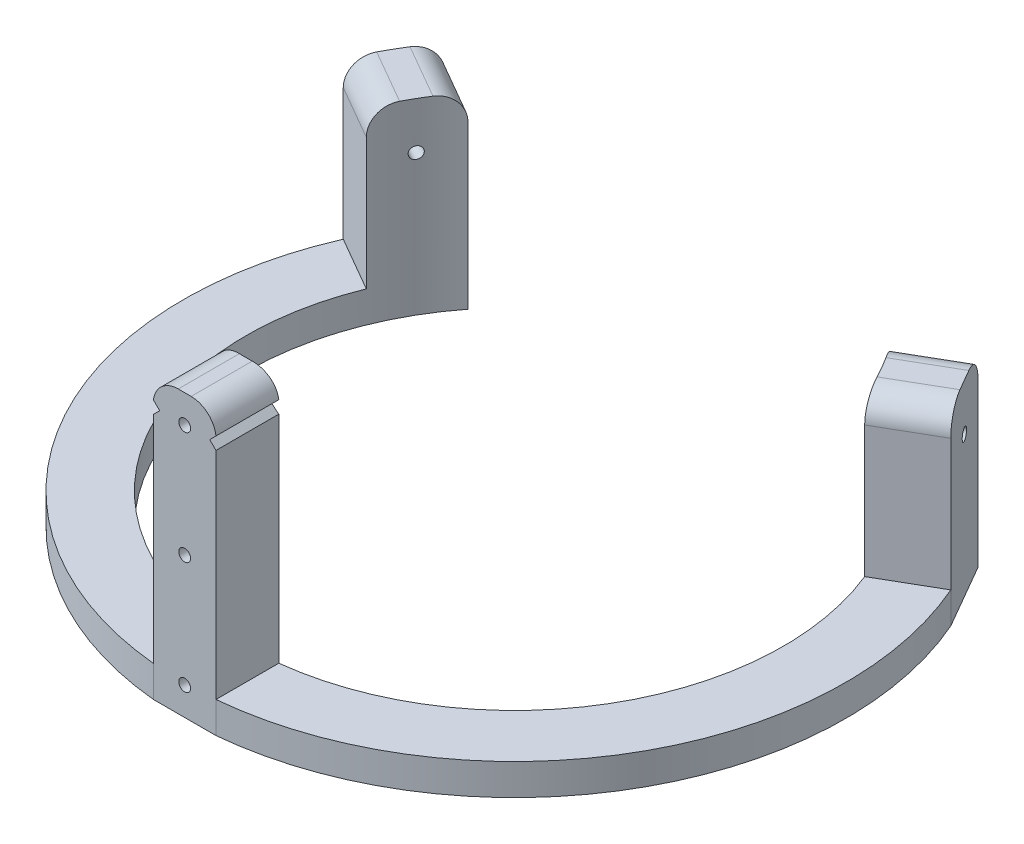
from build123d import *

# Parameters (mm, degrees)
SKETCH1_R               = 67.31
SKETCH1_R_2             = 54.61
BOSS_EXTRUDE1_DEPTH     = 57.15
CUT_EXTRUDE1_DEPTH      = 161.994729727
CUT_EXTRUDE1_DEPTH_BACK = 161.994729727
SKETCH2_R               = 1.2065
SKETCH3_R               = 1.2065
CUT_EXTRUDE2_DEPTH      = 171.985259226
CUT_EXTRUDE3_START      = -50.8
CUT_EXTRUDE3_DEPTH      = 50.8
SKETCH5_W               = 12.7
SKETCH5_H               = 152.473493429
CUT_EXTRUDE4_DEPTH      = 50.8
CUT_EXTRUDE5_START      = -19.05
CUT_EXTRUDE5_DEPTH      = 19.05
CUT_EXTRUDE6_START      = -19.05
CUT_EXTRUDE6_DEPTH      = 19.05
FILLET1_START           = 53
FILLET1_DEPTH           = 15
FILLET1_2_DEPTH         = 15
FILLET1_START_2         = -67.31
FILLET1_3_DEPTH         = 14.31
CUT_EXTRUDE7_START      = -19.05
CUT_EXTRUDE7_DEPTH      = 19.05


with BuildPart() as part:
    # Sketch1 → Boss-Extrude1 (new body)
    with BuildSketch(Plane(origin=(0, 0, 0), x_dir=(1, 0, 0), z_dir=(0, 1, 0))):
        with Locations(Location((0, 0, 0), (0, 0, 270))):
            Circle(SKETCH1_R)
        with Locations(Location((0, 0, 0), (0, 0, 270))):
            Circle(SKETCH1_R_2, mode=Mode.SUBTRACT)
    extrude(amount=BOSS_EXTRUDE1_DEPTH)

    # Sketch2 → Cut-Extrude1 (cut, two sides: drawn at the far end of the back side and taken through both)
    with BuildSketch(Plane.XY.offset(67.31).offset(-CUT_EXTRUDE1_DEPTH_BACK)):
        Polygon((-5.08, 51.435), (-6.35, 52.705), (-6.35, 50.165), align=None)
        Polygon((-6.35, 52.705), (-6.35, 57.15), (-19.05, 57.15), (-19.05, 25.0825), (-6.35, 25.0825), (-6.35, 50.165), align=None)
        Polygon((5.08, 51.435), (6.35, 50.165), (6.35, 52.705), align=None)
        Polygon((6.35, 50.165), (6.35, 25.0825), (19.05, 25.0825), (19.05, 57.15), (6.35, 57.15), (6.35, 52.705), align=None)
        with Locations((0, 51.435)):
            Circle(SKETCH2_R)
        with Locations((0, 28.575)):
            Circle(SKETCH2_R)
        with Locations((0, 5.715)):
            Circle(SKETCH2_R)
    extrude(amount=CUT_EXTRUDE1_DEPTH + CUT_EXTRUDE1_DEPTH_BACK, mode=Mode.SUBTRACT)

    # Sketch3 → Cut-Extrude2 (cut, through all)
    with BuildSketch(Plane(origin=(-58.292169929, 0, -33.655), x_dir=(0, -1, 0), z_dir=(-0.8660254037844364, 0, -0.5000000000000041))):
        with Locations(Location((-28.575, 0, 0), (0, 0, 90))):
            Circle(SKETCH3_R)
    cut_extrude2 = extrude(amount=-CUT_EXTRUDE2_DEPTH, mode=Mode.SUBTRACT)

    # Mirror1: Cut-Extrude2 across plane
    add(cut_extrude2.mirror(Plane(origin=(0, 0, 0), x_dir=(0, 0, 1), z_dir=(1, 0, 0))), mode=Mode.SUBTRACT)

    # Cut-Extrude3: read off the stored shape, not the designer's step
    # Cut-Extrude3 outline → Cut-Extrude3 (cut)
    with BuildSketch(Plane(origin=(0, 57.15, 0), x_dir=(1, 0, 0), z_dir=(0, 1, 0)).offset(CUT_EXTRUDE3_START)):
        with BuildLine():
            ThreePointArc((-6.35, -67.009802268), (0, -67.31), (6.35, -67.009802268))
            Line((6.35, -67.009802268), (-6.35, -67.009802268))
        make_face()
        with BuildLine():
            Line((6.35, -54.23955752), (6.35, -67.009802268))
            ThreePointArc((6.35, -67.009802268), (57.986556059, -34.178873833), (61.701920082, 26.898125551))
            Line((61.701920082, 26.898125551), (50.616947204, 20.498213476))
            ThreePointArc((50.616947204, 20.498213476), (46.986613751, -27.830023862), (6.35, -54.23955752))
        make_face()
        with BuildLine():
            Line((-6.35, -67.009802268), (-6.35, -54.23955752))
            ThreePointArc((-6.35, -54.23955752), (-46.986613751, -27.830023862), (-50.616947204, 20.498213476))
            Line((-50.616947204, 20.498213476), (-61.701920082, 26.898125551))
            ThreePointArc((-61.701920082, 26.898125551), (-57.986556059, -34.178873833), (-6.35, -67.009802268))
        make_face()
        with BuildLine():
            Line((54.145420082, 39.986367478), (61.701920082, 26.898125551))
            ThreePointArc((61.701920082, 26.898125551), (58.292169929, 33.655), (54.145420082, 39.986367478))
        make_face()
        with BuildLine():
            Line((-54.145420082, 39.986367478), (-43.060447204, 33.586455403))
            ThreePointArc((-43.060447204, 33.586455403), (0, 54.61), (43.060447204, 33.586455403))
            Line((43.060447204, 33.586455403), (54.145420082, 39.986367478))
            ThreePointArc((54.145420082, 39.986367478), (0, 67.31), (-54.145420082, 39.986367478))
        make_face()
    extrude(amount=CUT_EXTRUDE3_DEPTH, mode=Mode.SUBTRACT)

    # Sketch5 → Cut-Extrude4 (cut)
    with BuildSketch(Plane(origin=(0, 6.35, 0), x_dir=(1, 0, 0), z_dir=(0, 1, 0))):
        with Locations((0, 21.997189195)):
            Rectangle(SKETCH5_W, SKETCH5_H)
    extrude(amount=-CUT_EXTRUDE4_DEPTH, mode=Mode.SUBTRACT)

    # Sketch6 → Cut-Extrude5 (cut)
    with BuildSketch(Plane(origin=(0, 57.15, 0), x_dir=(1, 0, 0), z_dir=(0, 1, 0)).offset(CUT_EXTRUDE5_START)):
        with BuildLine():
            Line((50.616947204, 20.498213476), (61.701920082, 26.898125551))
            Line((61.701920082, 26.898125551), (54.145420082, 39.986367478))
            Line((54.145420082, 39.986367478), (43.060447204, 33.586455403))
            ThreePointArc((43.060447204, 33.586455403), (47.293647301, 27.305), (50.616947204, 20.498213476))
        make_face()
        with BuildLine():
            Line((-61.701920082, 26.898125551), (-50.616947204, 20.498213476))
            ThreePointArc((-50.616947204, 20.498213476), (-47.293647301, 27.305), (-43.060447204, 33.586455403))
            Line((-43.060447204, 33.586455403), (-54.145420082, 39.986367478))
            ThreePointArc((-54.145420082, 39.986367478), (-58.292169929, 33.655), (-61.701920082, 26.898125551))
        make_face()
    extrude(amount=CUT_EXTRUDE5_DEPTH, mode=Mode.SUBTRACT)

    # Sketch7 → Cut-Extrude6 (cut)
    with BuildSketch(Plane(origin=(0, 6.35, 0), x_dir=(1, 0, 0), z_dir=(0, 1, 0)).offset(CUT_EXTRUDE6_START)):
        with BuildLine():
            Line((6.35, 67.009802268), (6.35, 54.23955752))
            ThreePointArc((6.35, 54.23955752), (26.776589215, 47.594814528), (43.060447204, 33.586455403))
            Line((43.060447204, 33.586455403), (54.145420082, 39.986367478))
            ThreePointArc((54.145420082, 39.986367478), (33.128393708, 58.593051041), (6.35, 67.009802268))
        make_face()
        with BuildLine():
            Line((-6.35, 54.23955752), (-6.35, 67.009802268))
            ThreePointArc((-6.35, 67.009802268), (-33.128393708, 58.593051041), (-54.145420082, 39.986367478))
            Line((-54.145420082, 39.986367478), (-43.060447204, 33.586455403))
            ThreePointArc((-43.060447204, 33.586455403), (-26.776589215, 47.594814528), (-6.35, 54.23955752))
        make_face()
    extrude(amount=CUT_EXTRUDE6_DEPTH, mode=Mode.SUBTRACT)

    # Fillet1: read off the stored shape, not the designer's step
    # Fillet1 outline → Fillet1 (cut)
    with BuildSketch(Plane.XY.offset(FILLET1_START)):
        with BuildLine():
            Line((6.35, 57.15), (1.309843752, 57.15))
            ThreePointArc((1.309843752, 57.15), (4.669947917, 55.88), (6.35, 52.705))
            Line((6.35, 52.705), (6.35, 57.15))
        make_face()
        with BuildLine():
            ThreePointArc((-6.35, 52.705), (-4.669947917, 55.88), (-1.309843752, 57.15))
            Line((-1.309843752, 57.15), (-6.35, 57.15))
            Line((-6.35, 57.15), (-6.35, 52.705))
        make_face()
    extrude(amount=FILLET1_DEPTH, mode=Mode.SUBTRACT)

    # Fillet1 2 outline → Fillet1 2 (cut)
    with BuildSketch(Plane(origin=(0, 0, 0), x_dir=(0.5000000000000049, 0, 0.8660254037844358), z_dir=(0.8660254037844358, 0, -0.5000000000000049)).offset(FILLET1_START)):
        with BuildLine():
            Line((7.5565, -38.1), (7.5565, -33.02))
            ThreePointArc((7.5565, -33.02), (6.068602448, -36.612102448), (2.4765, -38.1))
            Line((2.4765, -38.1), (7.5565, -38.1))
        make_face()
        with BuildLine():
            Line((-7.5565, -38.1), (-2.4765, -38.1))
            ThreePointArc((-2.4765, -38.1), (-6.068602448, -36.612102448), (-7.5565, -33.02))
            Line((-7.5565, -33.02), (-7.5565, -38.1))
        make_face()
    extrude(amount=FILLET1_2_DEPTH, mode=Mode.SUBTRACT)

    # Fillet1 3 outline → Fillet1 3 (cut)
    with BuildSketch(Plane(origin=(0, 0, 0), x_dir=(0.49999999999999956, 0, -0.8660254037844389), z_dir=(0.8660254037844388, 0, 0.4999999999999999)).offset(FILLET1_START_2)):
        with BuildLine():
            Line((7.5565, 38.1), (2.4765, 38.1))
            ThreePointArc((2.4765, 38.1), (6.068602448, 36.612102448), (7.5565, 33.02))
            Line((7.5565, 33.02), (7.5565, 38.1))
        make_face()
        with BuildLine():
            ThreePointArc((-7.5565, 33.02), (-6.068602448, 36.612102448), (-2.4765, 38.1))
            Line((-2.4765, 38.1), (-7.5565, 38.1))
            Line((-7.5565, 38.1), (-7.5565, 33.02))
        make_face()
    extrude(amount=FILLET1_3_DEPTH, mode=Mode.SUBTRACT)

    # Sketch8 → Cut-Extrude7 (cut)
    with BuildSketch(Plane(origin=(0, 6.35, 0), x_dir=(1, 0, 0), z_dir=(0, 1, 0)).offset(CUT_EXTRUDE7_START)):
        with BuildLine():
            ThreePointArc((-6.35, -67.009802268), (-3.690833292, -67.208733433), (-1.025873896, -67.302181857))
            Line((-1.025873896, -67.302181857), (-1.025873896, -67.009802268))
            Line((-1.025873896, -67.009802268), (-6.35, -67.009802268))
        make_face()
        Polygon((-1.025873896, -67.009802268), (-1.025873896, -67.302181857), (-1.551971907, -68.232150278), (0.972160244, -68.180468419), (1.025873896, -67.302181857), (1.025873896, -67.009802268), align=None)
        with BuildLine():
            Line((6.35, -67.009802268), (1.025873896, -67.009802268))
            Line((1.025873896, -67.009802268), (1.025873896, -67.302181857))
            ThreePointArc((1.025873896, -67.302181857), (3.690833292, -67.208733433), (6.35, -67.009802268))
        make_face()
        with BuildLine():
            ThreePointArc((61.701920082, 26.898125551), (58.292169929, 33.655), (54.145420082, 39.986367478))
            Line((54.145420082, 39.986367478), (61.701920082, 26.898125551))
        make_face()
    extrude(amount=CUT_EXTRUDE7_DEPTH, mode=Mode.SUBTRACT)


solid = part.part
